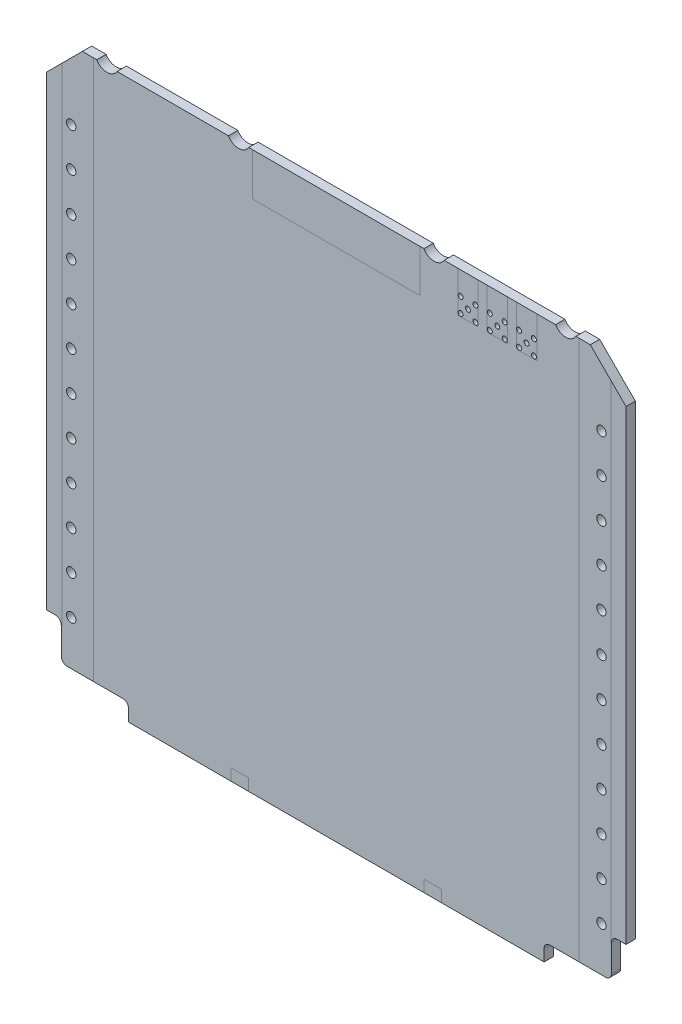
from build123d import *

# Parameters (mm, degrees)
SKETCH1_W                            = 99
SKETCH1_H                            = 95.3
BASICSIZE_DEPTH                      = 1.6
CHAMFER1_SIZE                        = 6.1
BACKPLANESIDESCREWCUTOUT_DEPTH       = 71.376203364
LPATTERN3_COUNT                      = 2
LPATTERN3_PITCH                      = 22.5
MIRROR3_COPY_1_DEPTH                 = 71.376203364
MIRROR3_COPY_2_DEPTH                 = 71.376203364
CUT_EXTRUDE4_DEPTH                   = 71.376203364
FILLET1_R                            = 1
FILLET1_OF_MIRROR1_R                 = 1
SKETCH5_R                            = 0.425
CUT_EXTRUDE3_DEPTH                   = 71.376203364
LPATTERN2_COUNT                      = 3
LPATTERN2_PITCH                      = 5
PARTFOOTPRINTS_W                     = 3.5
PARTFOOTPRINTS_H                     = 6.95
MMCXFOOTPRINT_DEPTH                  = 0.0001
SKETCH7_W                            = 28.575
SKETCH7_H                            = 7.293
TIGEREYEFOOTPRINT_DEPTH              = 0.0001
THERMALCONTACTS_UPPER_W              = 9.492158269
THERMALCONTACTS_UPPER_H              = 86.8
KEEPOUT_BOTTOM_DEPTH                 = 0.0001
CAUTION_TOP_START                    = -0.00015
CAUTION_TOP_DEPTH                    = 0.00015
HOLD_DOWNLOCATIONS_W                 = 3
HOLD_DOWNLOCATIONS_H                 = 2
HOLD_DOWNFOOTPRINTS_DEPTH            = 0.0001
CLEARANCES_SIDE_SIDE_COPY_1_SKETCH_W = 9.492158269
CLEARANCES_SIDE_SIDE_COPY_1_SKETCH_H = 86.8
CLEARANCES_SIDE_SIDE_COPY_1_DEPTH    = 0.0001
CLEARANCES_SIDE_SIDE_START           = -0.00015
CLEARANCES_SIDE_SIDE_COPY_2_DEPTH    = 0.00015
CLEARANCES_SIDE_SIDE_COPY_3_SKETCH_W = 3
CLEARANCES_SIDE_SIDE_COPY_3_SKETCH_H = 2
CLEARANCES_SIDE_SIDE_COPY_3_DEPTH    = 0.0001
CLEARANCES_SIDE_SIDE_COPY_4_SKETCH_W = 9.492158269
CLEARANCES_SIDE_SIDE_COPY_4_SKETCH_H = 86.8
CLEARANCES_SIDE_SIDE_COPY_4_DEPTH    = 0.0001
CLEARANCES_SIDE_SIDE_COPY_5_DEPTH    = 0.00015
CLEARANCES_SIDE_SIDE_COPY_6_SKETCH_W = 3
CLEARANCES_SIDE_SIDE_COPY_6_SKETCH_H = 2
CLEARANCES_SIDE_SIDE_COPY_6_DEPTH    = 0.0001
SKETCH8_R                            = 0.8
CUT_EXTRUDE5_DEPTH                   = 10


with BuildPart() as part:
    # Sketch1 → basicSize (new body)
    with BuildSketch(Plane(origin=(0, 0, -0.0125), x_dir=(-1, 0, 0), z_dir=(0, 0, -1))):
        with Locations((0, -2.35)):
            Rectangle(SKETCH1_W, SKETCH1_H)
    extrude(amount=-BASICSIZE_DEPTH)

    # Chamfer1
    chamfer1_edges = [part.edges().sort_by_distance(p)[0] for p in [
        (49.5, 45.3, 0.7875),
        (-49.5, 45.3, 0.7875),
    ]]
    chamfer(chamfer1_edges, length=CHAMFER1_SIZE)

    # Sketch4 → backplaneSideScrewCutout (cut, symmetric)
    with BuildSketch(Plane.XY.offset(1.5875)):
        with BuildLine():
            Line((37.467949192, 45.3), (40.932050808, 45.3))
            ThreePointArc((40.932050808, 45.3), (39.2, 44.3), (37.467949192, 45.3))
        make_face()
    backplanesidescrewcutout = extrude(amount=BACKPLANESIDESCREWCUTOUT_DEPTH, both=True, mode=Mode.SUBTRACT)

    # LPattern3: backplaneSideScrewCutout ×2
    with Locations(*[(-i * LPATTERN3_PITCH, 0, 0) for i in range(1, LPATTERN3_COUNT)]):
        add(backplanesidescrewcutout, mode=Mode.SUBTRACT)

    # Mirror3 copy 1 sketch → Mirror3 copy 1 (cut, symmetric)
    with BuildSketch(Plane(origin=(22.5, 0, 1.5875), x_dir=(-1, 0, 0), z_dir=(0, 0, 1))):
        with BuildLine():
            Line((37.467949192, -45.3), (40.932050808, -45.3))
            ThreePointArc((40.932050808, -45.3), (39.2, -44.3), (37.467949192, -45.3))
        make_face()
    extrude(amount=MIRROR3_COPY_1_DEPTH, both=True, mode=Mode.SUBTRACT)

    # Mirror3 copy 2 sketch → Mirror3 copy 2 (cut, symmetric)
    with BuildSketch(Plane(origin=(0, 0, 1.5875), x_dir=(-1, 0, 0), z_dir=(0, 0, 1))):
        with BuildLine():
            Line((37.467949192, -45.3), (40.932050808, -45.3))
            ThreePointArc((40.932050808, -45.3), (39.2, -44.3), (37.467949192, -45.3))
        make_face()
    extrude(amount=MIRROR3_COPY_2_DEPTH, both=True, mode=Mode.SUBTRACT)

    # Sketch6 → Cut-Extrude4 (cut, through all)
    with BuildSketch(Plane.XY.offset(1.5875)):
        Polygon((-49.5, -40.4), (-47, -40.4), (-47, -47), (-35.5, -47), (-35.5, -50), (-49.5, -50), align=None)
    cut_extrude4 = extrude(amount=-CUT_EXTRUDE4_DEPTH, mode=Mode.SUBTRACT)

    # Fillet1
    fillet1_edges = [part.edges().sort_by_distance(p)[0] for p in [
        (-35.5, -47, 0.7875),
        (-47, -47, 0.7875),
        (-47, -40.4, 0.7875),
    ]]
    fillet(fillet1_edges, radius=FILLET1_R)

    # Mirror1: Cut-Extrude4 across plane
    add(cut_extrude4.mirror(Plane(origin=(0, 0, 0), x_dir=(0, 0, 1), z_dir=(1, 0, 0))), mode=Mode.SUBTRACT)

    # Fillet1 of Mirror1
    fillet1_of_mirror1_edges = [part.edges().sort_by_distance(p)[0] for p in [
        (35.5, -47, 0.7875),
        (47, -47, 0.7875),
        (47, -40.4, 0.7875),
    ]]
    fillet(fillet1_of_mirror1_edges, radius=FILLET1_OF_MIRROR1_R)

    # Sketch5 → Cut-Extrude3 (cut, through all)
    with BuildSketch(Plane.XY.offset(1.5875)):
        with Locations((22.5, 40.1)):
            Circle(SKETCH5_R)
        with Locations((21.23, 41.37)):
            Circle(SKETCH5_R)
        with Locations((21.23, 38.83)):
            Circle(SKETCH5_R)
        with Locations((23.77, 41.37)):
            Circle(SKETCH5_R)
        with Locations((23.77, 38.83)):
            Circle(SKETCH5_R)
    cut_extrude3 = extrude(amount=-CUT_EXTRUDE3_DEPTH, mode=Mode.SUBTRACT)

    # LPattern2: Cut-Extrude3 ×3
    with Locations(*[(i * LPATTERN2_PITCH, 0, 0) for i in range(1, LPATTERN2_COUNT)]):
        add(cut_extrude3, mode=Mode.SUBTRACT)

    # partFootprints → MMCXfootprint (cut)
    with BuildSketch(Plane.XY.offset(1.5875)):
        with Locations((22.5, 41.825)):
            Rectangle(PARTFOOTPRINTS_W, PARTFOOTPRINTS_H)
        with Locations((27.5, 41.825)):
            Rectangle(PARTFOOTPRINTS_W, PARTFOOTPRINTS_H)
        with Locations((32.5, 41.825)):
            Rectangle(PARTFOOTPRINTS_W, PARTFOOTPRINTS_H)
    extrude(amount=-MMCXFOOTPRINT_DEPTH, mode=Mode.SUBTRACT)

    # Sketch7 → TigerEyeFootprint (cut)
    with BuildSketch(Plane.XY.offset(1.5875)):
        with Locations((0, 41.6535)):
            Rectangle(SKETCH7_W, SKETCH7_H)
    extrude(amount=-TIGEREYEFOOTPRINT_DEPTH, mode=Mode.SUBTRACT)

    # thermalContacts_upper → keepOut_bottom (cut)
    with BuildSketch(Plane.XY.offset(1.5875)):
        with Locations((-51.646079135, 1.9)):
            Rectangle(THERMALCONTACTS_UPPER_W, THERMALCONTACTS_UPPER_H)
    keepout_bottom = extrude(amount=-KEEPOUT_BOTTOM_DEPTH, mode=Mode.SUBTRACT)

    # Sketch3 → caution_top (cut)
    with BuildSketch(Plane.XY.offset(1.5875).offset(CAUTION_TOP_START)):
        with BuildLine():
            Line((-46.9, -41.5), (-47, -41.5))
            Line((-47, -41.5), (-47, -46))
            ThreePointArc((-47, -46), (-46.707106781, -46.707106781), (-46, -47))
            Line((-46, -47), (-41.5, -47))
            Line((-41.5, -47), (-41.5, 45.3))
            Line((-41.5, 45.3), (-46.9, 45.3))
            Line((-46.9, 45.3), (-46.9, -41.5))
        make_face()
    caution_top = extrude(amount=CAUTION_TOP_DEPTH, mode=Mode.SUBTRACT)

    # hold-downLocations → hold-downFootprints (cut)
    with BuildSketch(Plane.XY.offset(1.5875)):
        with Locations((16.5, -49)):
            Rectangle(HOLD_DOWNLOCATIONS_W, HOLD_DOWNLOCATIONS_H)
    hold_downfootprints = extrude(amount=-HOLD_DOWNFOOTPRINTS_DEPTH, mode=Mode.SUBTRACT)

    # clearances_top-bottom: keepOut_bottom, caution_top, hold-downFootprints across plane
    add(keepout_bottom.mirror(Plane.XY.offset(0.7875)), mode=Mode.SUBTRACT)
    add(caution_top.mirror(Plane.XY.offset(0.7875)), mode=Mode.SUBTRACT)
    add(hold_downfootprints.mirror(Plane.XY.offset(0.7875)), mode=Mode.SUBTRACT)

    # clearances_side-side copy 1 sketch → clearances_side-side copy 1 (cut)
    with BuildSketch(Plane(origin=(0, 0, -0.0125), x_dir=(-1, 0, 0), z_dir=(0, 0, -1))):
        with Locations((-51.646079135, 1.9)):
            Rectangle(CLEARANCES_SIDE_SIDE_COPY_1_SKETCH_W, CLEARANCES_SIDE_SIDE_COPY_1_SKETCH_H)
    extrude(amount=-CLEARANCES_SIDE_SIDE_COPY_1_DEPTH, mode=Mode.SUBTRACT)

    # clearances_side-side copy 2 sketch → clearances_side-side copy 2 (cut)
    with BuildSketch(Plane(origin=(0, 0, -0.0125), x_dir=(-1, 0, 0), z_dir=(0, 0, -1)).offset(CLEARANCES_SIDE_SIDE_START)):
        with BuildLine():
            Line((-46.9, -41.5), (-47, -41.5))
            Line((-47, -41.5), (-47, -46))
            ThreePointArc((-47, -46), (-46.707106781, -46.707106781), (-46, -47))
            Line((-46, -47), (-41.5, -47))
            Line((-41.5, -47), (-41.5, 45.3))
            Line((-41.5, 45.3), (-46.9, 45.3))
            Line((-46.9, 45.3), (-46.9, -41.5))
        make_face()
    extrude(amount=CLEARANCES_SIDE_SIDE_COPY_2_DEPTH, mode=Mode.SUBTRACT)

    # clearances_side-side copy 3 sketch → clearances_side-side copy 3 (cut)
    with BuildSketch(Plane(origin=(0, 0, -0.0125), x_dir=(-1, 0, 0), z_dir=(0, 0, -1))):
        with Locations((16.5, -49)):
            Rectangle(CLEARANCES_SIDE_SIDE_COPY_3_SKETCH_W, CLEARANCES_SIDE_SIDE_COPY_3_SKETCH_H)
    extrude(amount=-CLEARANCES_SIDE_SIDE_COPY_3_DEPTH, mode=Mode.SUBTRACT)

    # clearances_side-side copy 4 sketch → clearances_side-side copy 4 (cut)
    with BuildSketch(Plane(origin=(0, 0, 1.5875), x_dir=(-1, 0, 0), z_dir=(0, 0, 1))):
        with Locations((-51.646079135, -1.9)):
            Rectangle(CLEARANCES_SIDE_SIDE_COPY_4_SKETCH_W, CLEARANCES_SIDE_SIDE_COPY_4_SKETCH_H)
    extrude(amount=-CLEARANCES_SIDE_SIDE_COPY_4_DEPTH, mode=Mode.SUBTRACT)

    # clearances_side-side copy 5 sketch → clearances_side-side copy 5 (cut)
    with BuildSketch(Plane(origin=(0, 0, 1.5875), x_dir=(-1, 0, 0), z_dir=(0, 0, 1)).offset(CLEARANCES_SIDE_SIDE_START)):
        with BuildLine():
            Line((-46.9, 41.5), (-47, 41.5))
            Line((-47, 41.5), (-47, 46))
            ThreePointArc((-47, 46), (-46.707106781, 46.707106781), (-46, 47))
            Line((-46, 47), (-41.5, 47))
            Line((-41.5, 47), (-41.5, -45.3))
            Line((-41.5, -45.3), (-46.9, -45.3))
            Line((-46.9, -45.3), (-46.9, 41.5))
        make_face()
    extrude(amount=CLEARANCES_SIDE_SIDE_COPY_5_DEPTH, mode=Mode.SUBTRACT)

    # clearances_side-side copy 6 sketch → clearances_side-side copy 6 (cut)
    with BuildSketch(Plane(origin=(0, 0, 1.5875), x_dir=(-1, 0, 0), z_dir=(0, 0, 1))):
        with Locations((16.5, 49)):
            Rectangle(CLEARANCES_SIDE_SIDE_COPY_6_SKETCH_W, CLEARANCES_SIDE_SIDE_COPY_6_SKETCH_H)
    extrude(amount=-CLEARANCES_SIDE_SIDE_COPY_6_DEPTH, mode=Mode.SUBTRACT)

    # Sketch8 → Cut-Extrude5 (cut)
    with BuildSketch(Plane.XY.offset(1.5875)):
        with Locations((-45.3, 33.5)):
            Circle(SKETCH8_R)
        with Locations((-45.3, 26.872727273)):
            Circle(SKETCH8_R)
        with Locations((-45.3, 20.245454545)):
            Circle(SKETCH8_R)
        with Locations((-45.3, 13.618181818)):
            Circle(SKETCH8_R)
        with Locations((-45.3, 6.990909091)):
            Circle(SKETCH8_R)
        with Locations((-45.3, 0.363636364)):
            Circle(SKETCH8_R)
        with Locations((-45.3, -6.263636364)):
            Circle(SKETCH8_R)
        with Locations((-45.3, -12.890909091)):
            Circle(SKETCH8_R)
        with Locations((-45.3, -19.518181818)):
            Circle(SKETCH8_R)
        with Locations((-45.3, -26.145454545)):
            Circle(SKETCH8_R)
        with Locations((-45.3, -32.772727273)):
            Circle(SKETCH8_R)
        with Locations((-45.3, -39.4)):
            Circle(SKETCH8_R)
    cut_extrude5 = extrude(amount=-CUT_EXTRUDE5_DEPTH, mode=Mode.SUBTRACT)

    # Mirror4: Cut-Extrude5 across plane
    add(cut_extrude5.mirror(Plane(origin=(0, 0, 0), x_dir=(0, 0, 1), z_dir=(1, 0, 0))), mode=Mode.SUBTRACT)


solid = part.part
